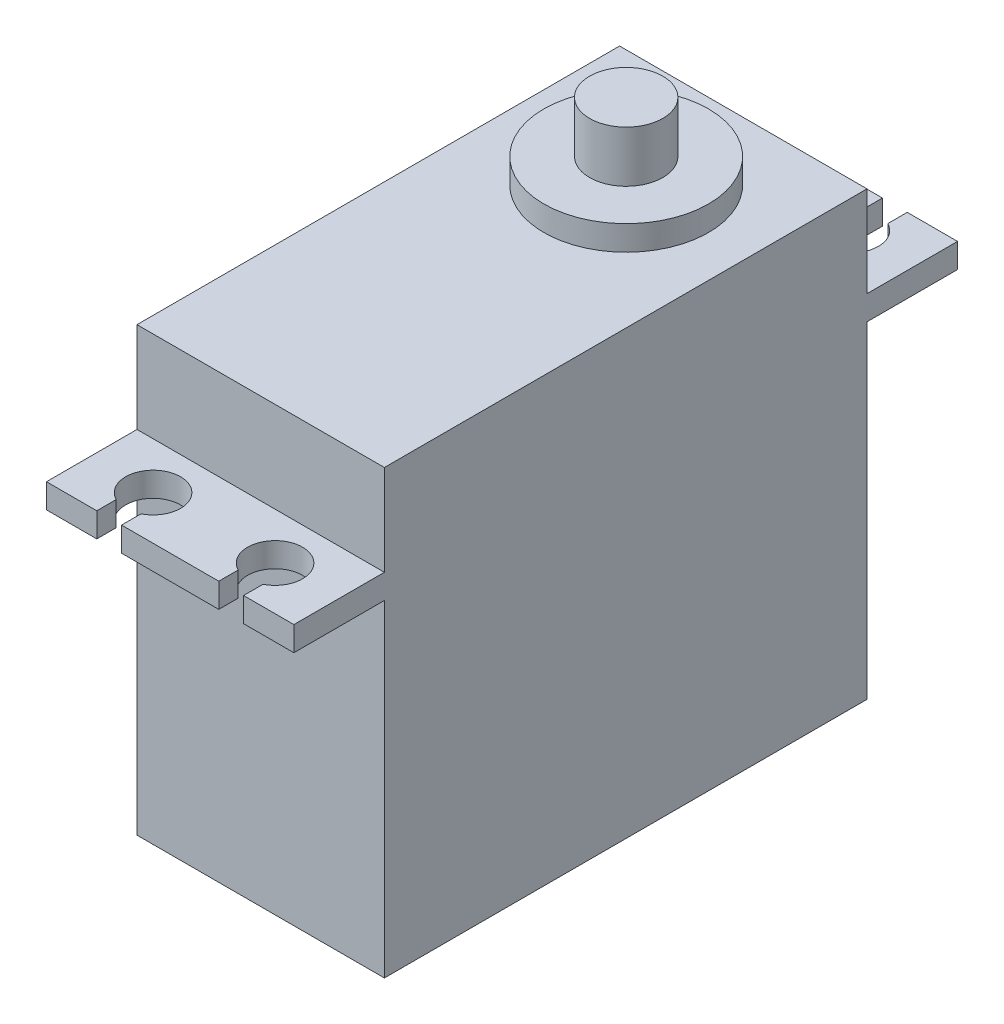
from build123d import *

# Parameters (mm, degrees)
SKETCH1_W           = 20.28
SKETCH1_H           = 39.56
BOSS_EXTRUDE1_DEPTH = 36.24
SKETCH2_R           = 6.75
BOSS_EXTRUDE2_DEPTH = 2.03
SKETCH3_W           = 20.28
SKETCH3_H           = 2
BOSS_EXTRUDE3_DEPTH = 7.42
SKETCH4_W           = 20.28
SKETCH4_H           = 2
BOSS_EXTRUDE4_DEPTH = 7.42
CUT_EXTRUDE1_DEPTH  = 47.432716914
SKETCH6_R           = 3
BOSS_EXTRUDE5_DEPTH = 4.2


with BuildPart() as part:
    # Sketch1 → Boss-Extrude1 (new body)
    with BuildSketch(Plane(origin=(0, 0, 0), x_dir=(1, 0, 0), z_dir=(0, 1, 0))):
        Rectangle(SKETCH1_W, SKETCH1_H)
    extrude(amount=BOSS_EXTRUDE1_DEPTH)

    # Sketch2 → Boss-Extrude2 (add)
    with BuildSketch(Plane(origin=(0, 36.24, 0), x_dir=(1, 0, 0), z_dir=(0, 1, 0))):
        with Locations((0, 10.18)):
            Circle(SKETCH2_R)
    extrude(amount=BOSS_EXTRUDE2_DEPTH)

    # Sketch3 → Boss-Extrude3 (add)
    with BuildSketch(Plane(origin=(0, 0, -19.78), x_dir=(-1, 0, 0), z_dir=(0, 0, -1))):
        with Locations((0, 27.8)):
            Rectangle(SKETCH3_W, SKETCH3_H)
    extrude(amount=BOSS_EXTRUDE3_DEPTH)

    # Sketch4 → Boss-Extrude4 (add)
    with BuildSketch(Plane.XY.offset(19.78)):
        with Locations((0, 27.8)):
            Rectangle(SKETCH4_W, SKETCH4_H)
    extrude(amount=BOSS_EXTRUDE4_DEPTH)

    # Sketch5 → Cut-Extrude1 (cut, through all)
    with BuildSketch(Plane(origin=(0, 36.24, 0), x_dir=(1, 0, 0), z_dir=(0, 1, 0))):
        with BuildLine():
            Line((-6.016, 25.607546762), (-6.016, 27.2))
            Line((-6.016, 27.2), (-3.984, 27.2))
            Line((-3.984, 27.2), (-3.984, 25.607546762))
            ThreePointArc((-3.984, 25.607546762), (-5, 21.35), (-6.016, 25.607546762))
        make_face()
        with BuildLine():
            Line((3.984, 25.607546762), (3.984, 27.2))
            Line((3.984, 27.2), (6.016, 27.2))
            Line((6.016, 27.2), (6.016, 25.607546762))
            ThreePointArc((6.016, 25.607546762), (5, 21.35), (3.984, 25.607546762))
        make_face()
        with BuildLine():
            Line((-6.016, -25.607546762), (-6.016, -27.2))
            Line((-6.016, -27.2), (-3.984, -27.2))
            Line((-3.984, -27.2), (-3.984, -25.607546762))
            ThreePointArc((-3.984, -25.607546762), (-5, -21.35), (-6.016, -25.607546762))
        make_face()
        with BuildLine():
            Line((3.984, -25.607546762), (3.984, -27.2))
            Line((3.984, -27.2), (6.016, -27.2))
            Line((6.016, -27.2), (6.016, -25.607546762))
            ThreePointArc((6.016, -25.607546762), (5, -21.35), (3.984, -25.607546762))
        make_face()
    extrude(amount=-CUT_EXTRUDE1_DEPTH, mode=Mode.SUBTRACT)

    # Sketch6 → Boss-Extrude5 (add)
    with BuildSketch(Plane(origin=(0, 38.27, 0), x_dir=(1, 0, 0), z_dir=(0, 1, 0))):
        with Locations((0, 10.18)):
            Circle(SKETCH6_R)
    extrude(amount=BOSS_EXTRUDE5_DEPTH)


solid = part.part
